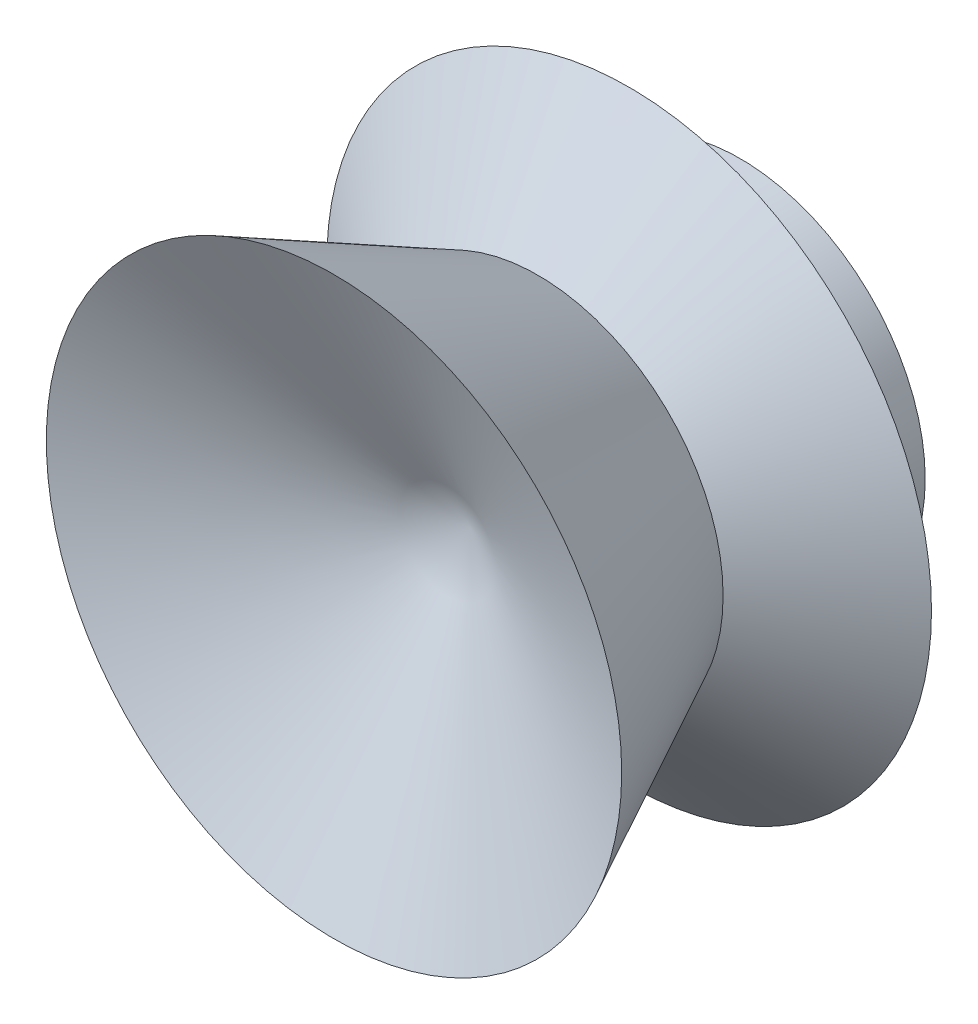
from build123d import *

# Parameters (mm, degrees)
SCALE1_SCALE = 0.2


with BuildPart() as part:
    # Sketch6 → Revolve1 (revolve)
    with BuildSketch(Plane(origin=(0, 0, 0), x_dir=(1, 0, 0), z_dir=(0, 1, 0))):
        Polygon((0, 330.588923101), (0, 104.832724157), (276.49457706, -25.932557505), (177.917672422, 170.10359979), (290.576992008, 257.727515023), (177.917672422, 271.809929971), (177.917672422, 364.351513917), align=None)
    revolve(axis=Axis((0, 0, 0), (0, 0, -1)))


with BuildPart() as part_1:
    # Scale1: scaled about (0, 0, -175.549695804)
    add(part.part.scale(SCALE1_SCALE).moved(Location((0, 0, -140.439756643))))


solid = part_1.part
